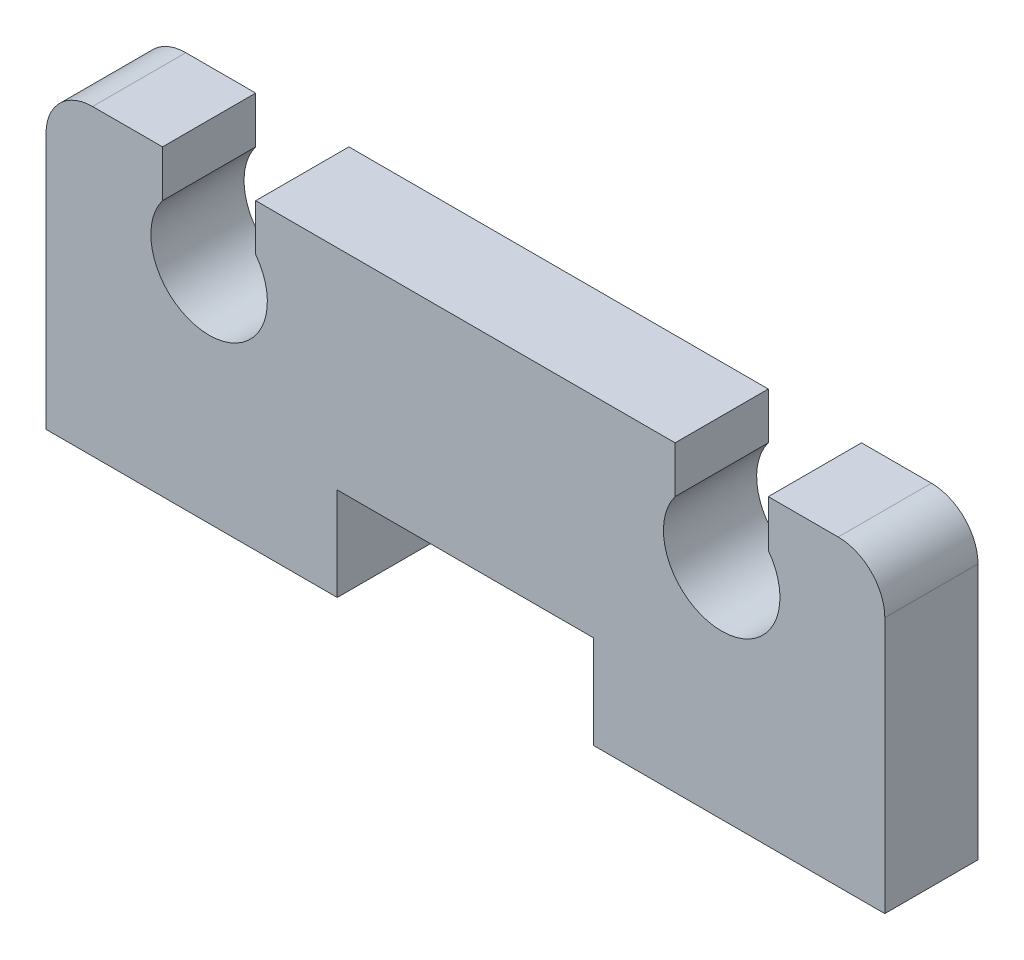
from build123d import *

# Parameters (mm, degrees)
TUBE_PLATE_BODY_DEPTH   = 2
TUBE_PLATE_CONTOURING_R = 1


with BuildPart() as part:
    # Sketch1 → Tube Plate Body (new body)
    with BuildSketch(Plane.XY):
        with BuildLine():
            Line((-9, 0), (-9, 6.5))
            Line((-9, 6.5), (-6.5, 6.5))
            Line((-6.5, 6.5), (-6.5, 5.5))
            ThreePointArc((-6.5, 5.5), (-5.5, 3.5), (-4.5, 5.5))
            Line((-4.5, 5.5), (-4.5, 6.5))
            Line((-4.5, 6.5), (4.5, 6.5))
            Line((4.5, 6.5), (4.5, 5.5))
            ThreePointArc((4.5, 5.5), (5.5, 3.5), (6.5, 5.5))
            Line((6.5, 5.5), (6.5, 6.5))
            Line((6.5, 6.5), (9, 6.5))
            Line((9, 6.5), (9, 0))
            Line((9, 0), (2.75, 0))
            Line((2.75, 0), (2.75, 2))
            Line((2.75, 2), (-2.75, 2))
            Line((-2.75, 2), (-2.75, 0))
            Line((-2.75, 0), (-9, 0))
        make_face()
    extrude(amount=TUBE_PLATE_BODY_DEPTH)

    # Tube Plate Contouring
    tube_plate_contouring_edges = [part.edges().sort_by_distance(p)[0] for p in [
        (9, 6.5, 1),
        (-9, 6.5, 1),
    ]]
    fillet(tube_plate_contouring_edges, radius=TUBE_PLATE_CONTOURING_R)


solid = part.part
